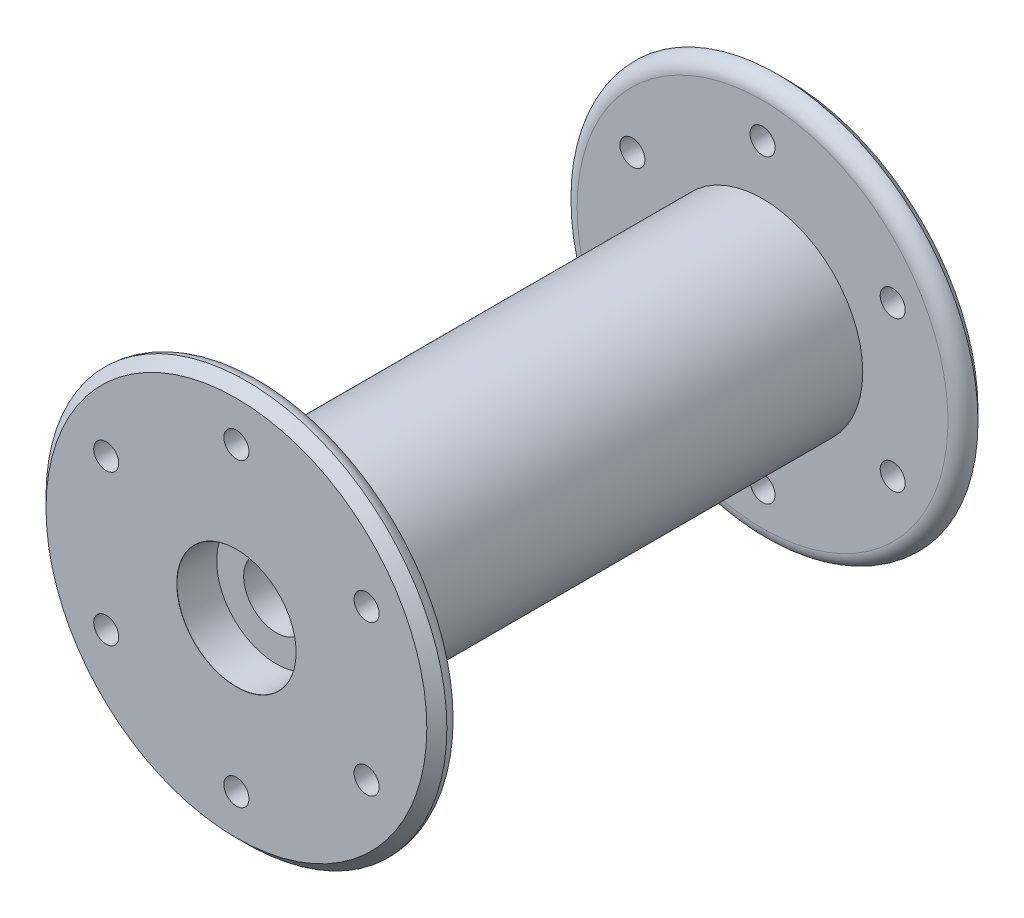
from build123d import *

# Parameters (mm, degrees)
SKETCH1_R                = 20
BOSS_EXTRUDE1_DEPTH      = 50
SKETCH2_R                = 40
BOSS_EXTRUDE2_DEPTH      = 5
CHAMFER1_SIZE            = 2
SKETCH3_R                = 2.5
CUT_EXTRUDE1_DEPTH       = 120.268604419
CIRPATTERN1_COUNT        = 6
FILLET1_R                = 3
MIRROR2_COPY_1_SKETCH_R  = 2.5
MIRROR2_COPY_1_DEPTH     = 120.268604419
MIRROR2_COPY_2_SKETCH_R  = 2.5
MIRROR2_COPY_2_DEPTH     = 120.268604419
MIRROR2_COPY_3_SKETCH_R  = 2.5
MIRROR2_COPY_3_DEPTH     = 120.268604419
MIRROR2_COPY_4_SKETCH_R  = 2.5
MIRROR2_COPY_4_DEPTH     = 120.268604419
MIRROR2_COPY_5_SKETCH_R  = 2.5
MIRROR2_COPY_5_DEPTH     = 120.268604419
CHAMFER1_OF_MIRROR2_SIZE = 2
FILLET1_OF_MIRROR2_R     = 3


with BuildPart() as part:
    # Sketch1 → Boss-Extrude1 (new, symmetric)
    with BuildSketch(Plane.XY):
        Circle(SKETCH1_R)
    extrude(amount=BOSS_EXTRUDE1_DEPTH, both=True)

    # Sketch2 → Boss-Extrude2 (add)
    with BuildSketch(Plane.XY.offset(50)):
        Circle(SKETCH2_R)
    boss_extrude2 = extrude(amount=BOSS_EXTRUDE2_DEPTH)

    # Chamfer1
    chamfer1_edges = [part.edges().sort_by_distance(p)[0] for p in [
        (-40, 0, 55),
    ]]
    chamfer(chamfer1_edges, length=CHAMFER1_SIZE)

    # Sketch3 → Cut-Extrude1 (cut, through all)
    with BuildSketch(Plane.XY.offset(55)):
        with Locations((0, 30)):
            Circle(SKETCH3_R)
    cut_extrude1 = extrude(amount=-CUT_EXTRUDE1_DEPTH, mode=Mode.SUBTRACT)

    # CirPattern1: Cut-Extrude1 ×6 about axis
    cirpattern1_axis = Axis((0, 0, 0), (0, 0, 1))
    for i in range(1, CIRPATTERN1_COUNT):
        add(cut_extrude1.rotate(cirpattern1_axis, i * 360 / CIRPATTERN1_COUNT), mode=Mode.SUBTRACT)

    # Fillet1
    fillet1_edges = [part.edges().sort_by_distance(p)[0] for p in [
        (-40, 0, 50),
    ]]
    fillet(fillet1_edges, radius=FILLET1_R - 0.0001)  # a hair under: the kernel refuses the full size

    # Sketch5 → CBORE for M12 Hex Head Bolt1 (revolve, cut)
    with BuildSketch(Plane(origin=(0, 0, 55), x_dir=(0, -1, 0), z_dir=(1, 0, 0))):
        Polygon((0, 0), (0, 110), (6.5, 110), (6.5, 7.95), (11.89, 7.95), (11.89, 0.025), (11.915, 0), align=None)
    cbore_for_m12_hex_head_bolt1 = revolve(axis=Axis((0, 0, 61.35), (0, 0, -1)), mode=Mode.SUBTRACT)

    # Mirror2: Boss-Extrude2, Cut-Extrude1, CBORE for M12 Hex Head Bolt1 across plane
    add(boss_extrude2.mirror(Plane.XY))
    add(cut_extrude1.mirror(Plane.XY), mode=Mode.SUBTRACT)
    add(cbore_for_m12_hex_head_bolt1.mirror(Plane.XY), mode=Mode.SUBTRACT)

    # Mirror2 copy 1 sketch → Mirror2 copy 1 (cut, through all)
    with BuildSketch(Plane(origin=(0, 0, -55), x_dir=(0.5000000000000001, 0.8660254037844386, 0), z_dir=(0, 0, -1))):
        with Locations((0, -30)):
            Circle(MIRROR2_COPY_1_SKETCH_R)
    extrude(amount=-MIRROR2_COPY_1_DEPTH, mode=Mode.SUBTRACT)

    # Mirror2 copy 2 sketch → Mirror2 copy 2 (cut, through all)
    with BuildSketch(Plane(origin=(0, 0, -55), x_dir=(-0.4999999999999998, 0.8660254037844387, 0), z_dir=(0, 0, -1))):
        with Locations((0, -30)):
            Circle(MIRROR2_COPY_2_SKETCH_R)
    extrude(amount=-MIRROR2_COPY_2_DEPTH, mode=Mode.SUBTRACT)

    # Mirror2 copy 3 sketch → Mirror2 copy 3 (cut, through all)
    with BuildSketch(Plane(origin=(0, 0, -55), x_dir=(-1, 0, 0), z_dir=(0, 0, -1))):
        with Locations((0, -30)):
            Circle(MIRROR2_COPY_3_SKETCH_R)
    extrude(amount=-MIRROR2_COPY_3_DEPTH, mode=Mode.SUBTRACT)

    # Mirror2 copy 4 sketch → Mirror2 copy 4 (cut, through all)
    with BuildSketch(Plane(origin=(0, 0, -55), x_dir=(-0.5000000000000004, -0.8660254037844384, 0), z_dir=(0, 0, -1))):
        with Locations((0, -30)):
            Circle(MIRROR2_COPY_4_SKETCH_R)
    extrude(amount=-MIRROR2_COPY_4_DEPTH, mode=Mode.SUBTRACT)

    # Mirror2 copy 5 sketch → Mirror2 copy 5 (cut, through all)
    with BuildSketch(Plane(origin=(0, 0, -55), x_dir=(0.5000000000000001, -0.8660254037844386, 0), z_dir=(0, 0, -1))):
        with Locations((0, -30)):
            Circle(MIRROR2_COPY_5_SKETCH_R)
    extrude(amount=-MIRROR2_COPY_5_DEPTH, mode=Mode.SUBTRACT)

    # Chamfer1 of Mirror2
    chamfer1_of_mirror2_edges = [part.edges().sort_by_distance(p)[0] for p in [
        (-40, 0, -55),
    ]]
    chamfer(chamfer1_of_mirror2_edges, length=CHAMFER1_OF_MIRROR2_SIZE)

    # Fillet1 of Mirror2
    fillet1_of_mirror2_edges = [part.edges().sort_by_distance(p)[0] for p in [
        (-40, 0, -50),
    ]]
    fillet(fillet1_of_mirror2_edges, radius=FILLET1_OF_MIRROR2_R - 0.0001)  # a hair under: the kernel refuses the full size


solid = part.part
